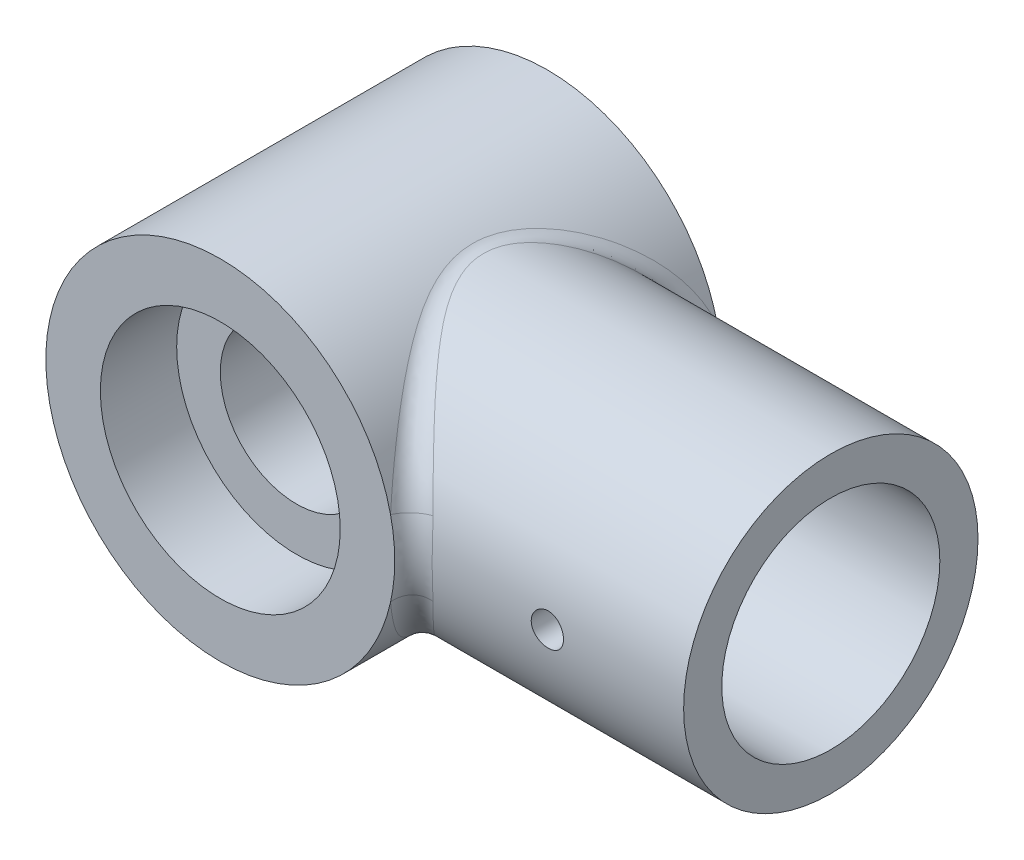
from build123d import *

# Parameters (mm, degrees)
SKETCH1_W                       = 16
SKETCH1_H                       = 30
SKETCH2_W                       = 32.412217981
SKETCH2_H                       = 13.5
F_20_0_20_DIAMETER_HOLE1_D      = 20
F_20_0_20_DIAMETER_HOLE1_DEPTH  = 25
F_4_0_2_96_DIAMETER_HOLE1_D     = 2.96
F_4_0_2_96_DIAMETER_HOLE1_DEPTH = 5.202041528
FILLET1_R                       = 2.000083172
SKETCH8_R                       = 1.48
CUT_EXTRUDE1_DEPTH              = 47.497311905
SCALE1_SCALE                    = 1.25


with BuildPart() as part:
    # Sketch1 → Revolve1 (revolve)
    with BuildSketch(Plane.XZ, mode=Mode.PRIVATE) as revolve1_sk:
        with Locations((8, 15)):
            Rectangle(SKETCH1_W, SKETCH1_H)
    revolve(revolve1_sk.sketch.rotate(Axis((0, 0, 30), (0, 0, -1)), 180), axis=Axis((0, 0, 30), (0, 0, -1)))

    # Sketch2 → Revolve2 (revolve)
    with BuildSketch(Plane(origin=(0, -4.254877545, 1.323753804), x_dir=(-1, 0, 0), z_dir=(0, 0.9548558773058256, -0.29706944234391125)), mode=Mode.PRIVATE) as revolve2_sk:
        with Locations((-24.79389101, 21.07283816)):
            Rectangle(SKETCH2_W, SKETCH2_H)
    revolve(revolve2_sk.sketch.rotate(Axis((41, 0, 15), (-1, 0, 0)), 342.718328232), axis=Axis((41, 0, 15), (-1, 0, 0)))

    # Sketch3 → Cut-Revolve1 (revolve, cut)
    with BuildSketch(Plane.XZ, mode=Mode.PRIVATE) as cut_revolve1_sk:
        Polygon((11, 30), (0, 30), (0, 0), (11, 0), (11, 7), (7, 7), (7, 23), (11, 23), align=None)
    revolve(cut_revolve1_sk.sketch.rotate(Axis((0, 0, 30), (0, 0, -1)), 180), axis=Axis((0, 0, 30), (0, 0, -1)), mode=Mode.SUBTRACT)

    # Ø20.0 (20) Diameter Hole1
    with Locations(Plane(origin=(41, 0, 0), x_dir=(0, 0, -1), z_dir=(1, 0, 0))):
        with Locations((-15, 0)):
            Hole(F_20_0_20_DIAMETER_HOLE1_D / 2, depth=F_20_0_20_DIAMETER_HOLE1_DEPTH)

    # Ø4.0 (2.96) Diameter Hole1
    with Locations(Plane.XY.offset(5.202041528)):
        with Locations((28.5, 0)):
            Hole(F_4_0_2_96_DIAMETER_HOLE1_D / 2, depth=F_4_0_2_96_DIAMETER_HOLE1_DEPTH)

    # Fillet1
    fillet1_edges = [part.edges().sort_by_distance(p)[0] for p in [
        (16, 0, 1.5),
    ]]
    fillet(fillet1_edges, radius=FILLET1_R)

    # Sketch8 → Cut-Extrude1 (cut, through all)
    with BuildSketch(Plane(origin=(0, 0, 15), x_dir=(-1, 0, 0), z_dir=(0, 0, -1))):
        with Locations(Location((-28.5, 0, 0), (0, 0, 180))):
            Circle(SKETCH8_R)
    extrude(amount=-CUT_EXTRUDE1_DEPTH, mode=Mode.SUBTRACT)


with BuildPart() as part_1:
    # Scale1: scaled about (0, 0, 0)
    add(part.part.scale(SCALE1_SCALE))


solid = part_1.part
